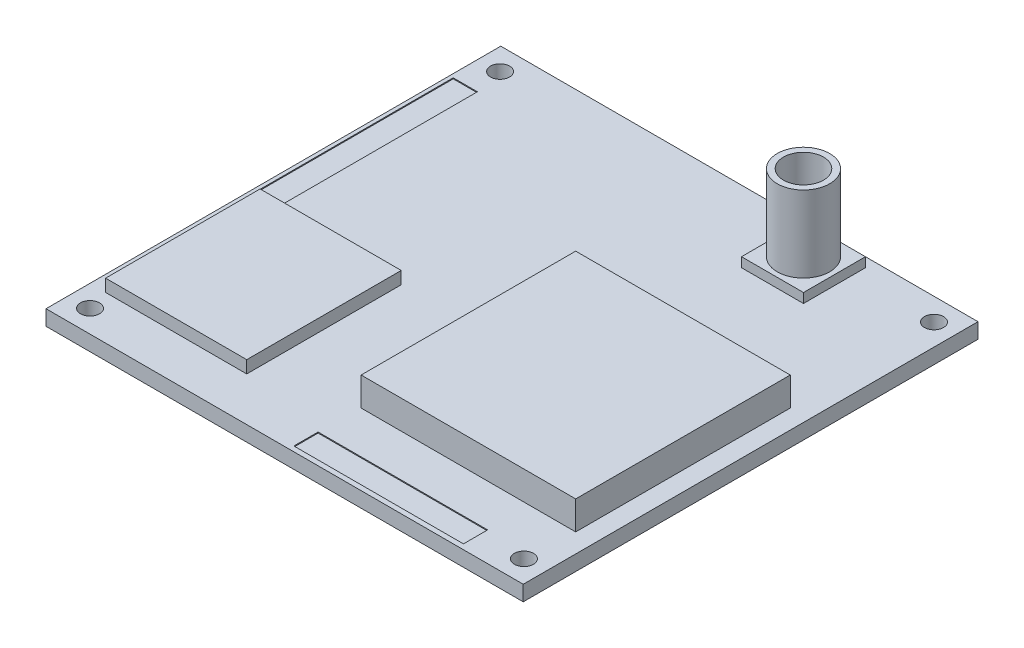
from build123d import *

# Parameters (mm, degrees)
SKETCH_2_W          = 50.043
SKETCH_2_H          = 47.687
EXTRUDE_1_DEPTH     = 1.6
SKETCH_3_R          = 1
CUT_EXTRUDE_1_DEPTH = 1.6
SKETCH_4_W          = 22.5
SKETCH_4_H          = 22.5
EXTRUDE_2_DEPTH     = 3
SKETCH_5_W          = 14.8
SKETCH_5_H          = 16.2
EXTRUDE_3_DEPTH     = 1.3
SKETCH_6_W          = 2.54
SKETCH_6_H          = 20.32
SKETCH_6_W_2        = 17.78
SKETCH_6_H_2        = 2.54
CUT_EXTRUDE_2_DEPTH = 0.1
SKETCH_7_W          = 6.5
SKETCH_7_H          = 6.5
EXTRUDE_4_DEPTH     = 1
SKETCH_8_R          = 2.75
EXTRUDE_5_DEPTH     = 8
SKETCH_9_R          = 2.1
CUT_EXTRUDE_3_DEPTH = 3


with BuildPart() as part:
    # 草图2 → 凸台-拉伸1 (new body)
    with BuildSketch(Plane(origin=(0, 0, 0), x_dir=(1, 0, 0), z_dir=(0, 1, 0))):
        Rectangle(SKETCH_2_W, SKETCH_2_H)
    extrude(amount=EXTRUDE_1_DEPTH)

    # 草图3 → 切除-拉伸1 (cut)
    with BuildSketch(Plane(origin=(0, 1.6, 0), x_dir=(1, 0, 0), z_dir=(0, 1, 0))):
        with Locations((-22.75, 21.5)):
            Circle(SKETCH_3_R)
        with Locations((22.75, 21.5)):
            Circle(SKETCH_3_R)
        with Locations((22.75, -21.5)):
            Circle(SKETCH_3_R)
        with Locations((-22.75, -21.5)):
            Circle(SKETCH_3_R)
    extrude(amount=-CUT_EXTRUDE_1_DEPTH, mode=Mode.SUBTRACT)

    # 草图4 → 凸台-拉伸2 (add)
    with BuildSketch(Plane(origin=(0, 1.6, 0), x_dir=(1, 0, 0), z_dir=(0, 1, 0))):
        with Locations((11.7715, -5.0935)):
            Rectangle(SKETCH_4_W, SKETCH_4_H)
    extrude(amount=EXTRUDE_2_DEPTH)

    # 草图5 → 凸台-拉伸3 (add)
    with BuildSketch(Plane(origin=(0, 1.6, 0), x_dir=(1, 0, 0), z_dir=(0, 1, 0))):
        with Locations((-15.9715, -11.1435)):
            Rectangle(SKETCH_5_W, SKETCH_5_H)
    extrude(amount=EXTRUDE_3_DEPTH)

    # 草图6 → 切除-拉伸2 (cut)
    with BuildSketch(Plane(origin=(0, 1.6, 0), x_dir=(1, 0, 0), z_dir=(0, 1, 0))):
        with Locations((-23.3715, 8.3165)):
            Rectangle(SKETCH_6_W, SKETCH_6_H)
        with Locations((9.3315, -22.0435)):
            Rectangle(SKETCH_6_W_2, SKETCH_6_H_2)
    extrude(amount=-CUT_EXTRUDE_2_DEPTH, mode=Mode.SUBTRACT)

    # 草图7 → 凸台-拉伸4 (add)
    with BuildSketch(Plane(origin=(0, 1.6, 0), x_dir=(1, 0, 0), z_dir=(0, 1, 0))):
        with Locations((10.9715, 19.5935)):
            Rectangle(SKETCH_7_W, SKETCH_7_H)
    extrude(amount=EXTRUDE_4_DEPTH)

    # 草图8 → 凸台-拉伸5 (add)
    with BuildSketch(Plane(origin=(0, 2.6, 0), x_dir=(1, 0, 0), z_dir=(0, 1, 0))):
        with Locations((10.9715, 19.5935)):
            Circle(SKETCH_8_R)
    extrude(amount=EXTRUDE_5_DEPTH)

    # 草图9 → 切除-拉伸3 (cut)
    with BuildSketch(Plane(origin=(0, 10.6, 0), x_dir=(1, 0, 0), z_dir=(0, 1, 0))):
        with Locations((10.9715, 19.5935)):
            Circle(SKETCH_9_R)
    extrude(amount=-CUT_EXTRUDE_3_DEPTH, mode=Mode.SUBTRACT)


solid = part.part
